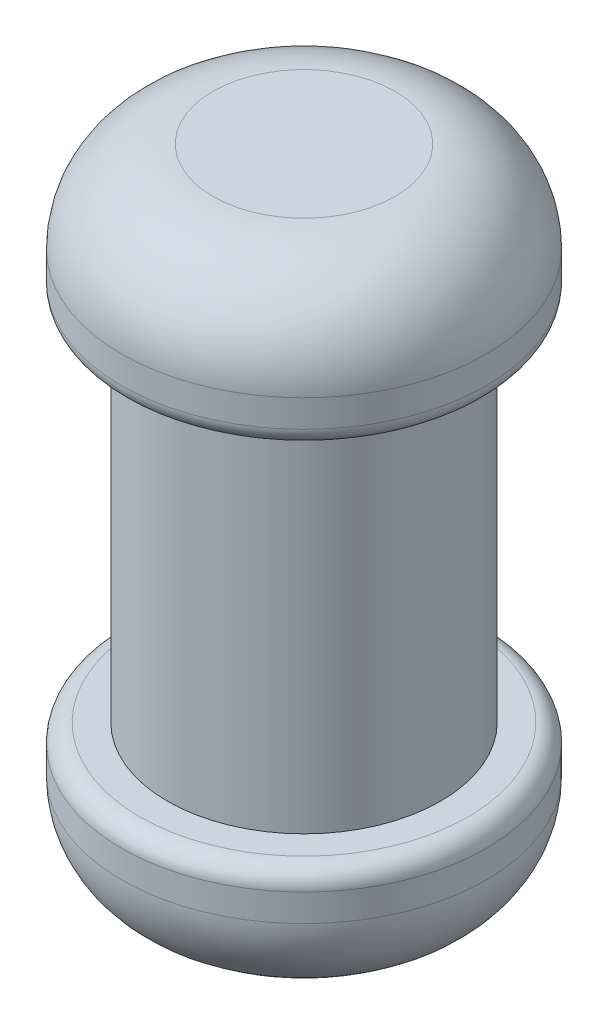
from build123d import *

# Parameters (mm, degrees)
SKETCH1_R            = 1.5
BOSS_EXTRUDE1_DEPTH  = 2
SKETCH2_R            = 2
BOSS_EXTRUDE2_DEPTH  = 1.5
FILLET1_R            = 1
FILLET2_R            = 0.2
FILLET1_OF_MIRROR2_R = 1
FILLET2_OF_MIRROR2_R = 0.2


with BuildPart() as part:
    # Sketch1 → Boss-Extrude1 (new body)
    with BuildSketch(Plane(origin=(0, 0, 0), x_dir=(1, 0, 0), z_dir=(0, 1, 0))):
        Circle(SKETCH1_R)
    boss_extrude1 = extrude(amount=BOSS_EXTRUDE1_DEPTH)

    # Sketch2 → Boss-Extrude2 (add)
    with BuildSketch(Plane(origin=(0, 2, 0), x_dir=(1, 0, 0), z_dir=(0, 1, 0))):
        Circle(SKETCH2_R)
    boss_extrude2 = extrude(amount=BOSS_EXTRUDE2_DEPTH)

    # Fillet1
    fillet1_edges = [part.edges().sort_by_distance(p)[0] for p in [
        (-2, 3.5, 0),
    ]]
    fillet(fillet1_edges, radius=FILLET1_R)

    # Fillet2
    fillet2_edges = [part.edges().sort_by_distance(p)[0] for p in [
        (-2, 2, 0),
    ]]
    fillet(fillet2_edges, radius=FILLET2_R)

    # Mirror2: Boss-Extrude1, Boss-Extrude2 across plane
    add(boss_extrude1.mirror(Plane.ZX))
    add(boss_extrude2.mirror(Plane.ZX))

    # Fillet1 of Mirror2
    fillet1_of_mirror2_edges = [part.edges().sort_by_distance(p)[0] for p in [
        (-2, -3.5, 0),
    ]]
    fillet(fillet1_of_mirror2_edges, radius=FILLET1_OF_MIRROR2_R)

    # Fillet2 of Mirror2
    fillet2_of_mirror2_edges = [part.edges().sort_by_distance(p)[0] for p in [
        (-2, -2, 0),
    ]]
    fillet(fillet2_of_mirror2_edges, radius=FILLET2_OF_MIRROR2_R)


solid = part.part
